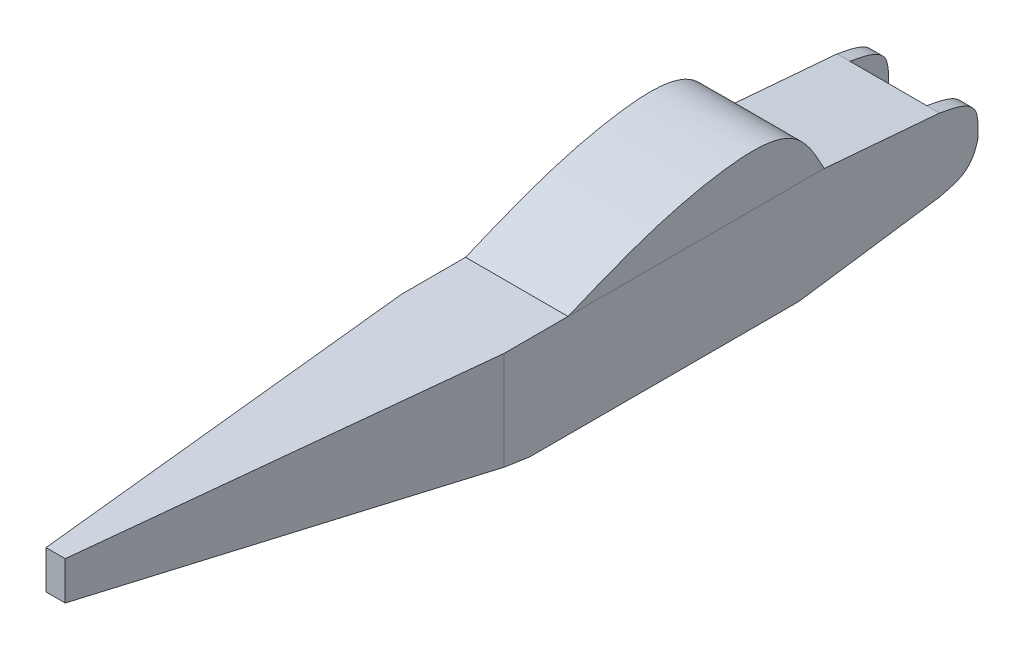
from build123d import *

# Parameters (mm, degrees)
EXTRUDE_1_DEPTH     = 80
CUT_EXTRUDE_1_DEPTH = 572.314274283
CUT_EXTRUDE_3_DEPTH = 80
SKETCH_4_W          = 60
SKETCH_4_H          = 53.972449548
CUT_EXTRUDE_4_DEPTH = 200
EXTRUDE_2_DEPTH     = 80


# Read off the part's stored shape, not the designer's step: 切除-拉伸3
with BuildPart() as part:
    # 草图1 → 拉伸1 (new body)
    with BuildSketch(Plane(origin=(0, 0, 0), x_dir=(0, 0, -1), z_dir=(1, 0, 0))):
        Polygon((0, 0), (120, -10), (120, -60), (-20, -80), (-230, -80), (-560, -30), (-560, 0), align=None)
    extrude(amount=EXTRUDE_1_DEPTH)

    # 草图2 → 切除-拉伸1 (cut, through all)
    with BuildSketch(Plane(origin=(0, 0, 0), x_dir=(1, 0, 0), z_dir=(0, 1, 0))):
        Polygon((-123.214670982, -250), (0, -250), (32.5, -560), (47.5, -560), (80, -250), (223.387270766, -250), (223.387270766, -944.244796541), (-123.214670982, -944.244796541), align=None)
    extrude(amount=-CUT_EXTRUDE_1_DEPTH, mode=Mode.SUBTRACT)

    # 切除-拉伸3 outline → 切除-拉伸3 (cut)
    with BuildSketch(Plane(origin=(0, 0, 0), x_dir=(0, 0, -1), z_dir=(1, 0, 0))):
        with BuildLine():
            Line((120, -10), (90, -7.5))
            add(Edge.make_bspline(
                [(90, -7.5), (102.569578594, -9.785522719), (118.163665106, -12.620990808), (119.701695558, -26.218981675), (120, -28.856342384)],
                knots=[0, 0, 0, 0, 0.806047766, 1, 1, 1, 1], degree=3))
            Line((120, -28.856342384), (120, -10))
        make_face()
        with BuildLine():
            Line((120, -60), (120, -39.772521617))
            add(Edge.make_bspline(
                [(120, -39.772521617), (114.843141559, -60.677011253), (101.385924703, -60.912360271), (90, -64.285714286)],
                knots=[0, 0, 0, 0, 1, 1, 1, 1], degree=3))
            Line((90, -64.285714286), (120, -60))
        make_face()
    extrude(amount=CUT_EXTRUDE_3_DEPTH, mode=Mode.SUBTRACT)

    # 草图4 → 切除-拉伸4 (cut)
    with BuildSketch(Plane(origin=(0, 0, 0), x_dir=(1, 0, 0), z_dir=(0, 1, 0))):
        with Locations((40, 116.986224774)):
            Rectangle(SKETCH_4_W, SKETCH_4_H)
    extrude(amount=-CUT_EXTRUDE_4_DEPTH, mode=Mode.SUBTRACT)


with BuildPart() as body_2:
    # 草图5 → 拉伸2 (new body)
    with BuildSketch(Plane(origin=(0, 0, 0), x_dir=(0, 0, -1), z_dir=(1, 0, 0))):
        with BuildLine():
            Line((-200, 0), (0, 0))
            add(Edge.make_bspline(
                [(0, 0), (-6.294299224, 11.901459338), (-22.767386249, 43.049291436), (-108.644216453, 38.00822116), (-163.451278249, 15.205954626), (-200, 0)],
                knots=[0, 0, 0, 0, 0.170815498, 0.447048744, 1, 1, 1, 1], degree=3))
        make_face()
    extrude(amount=EXTRUDE_2_DEPTH)


solid = Compound([part.part, body_2.part])
